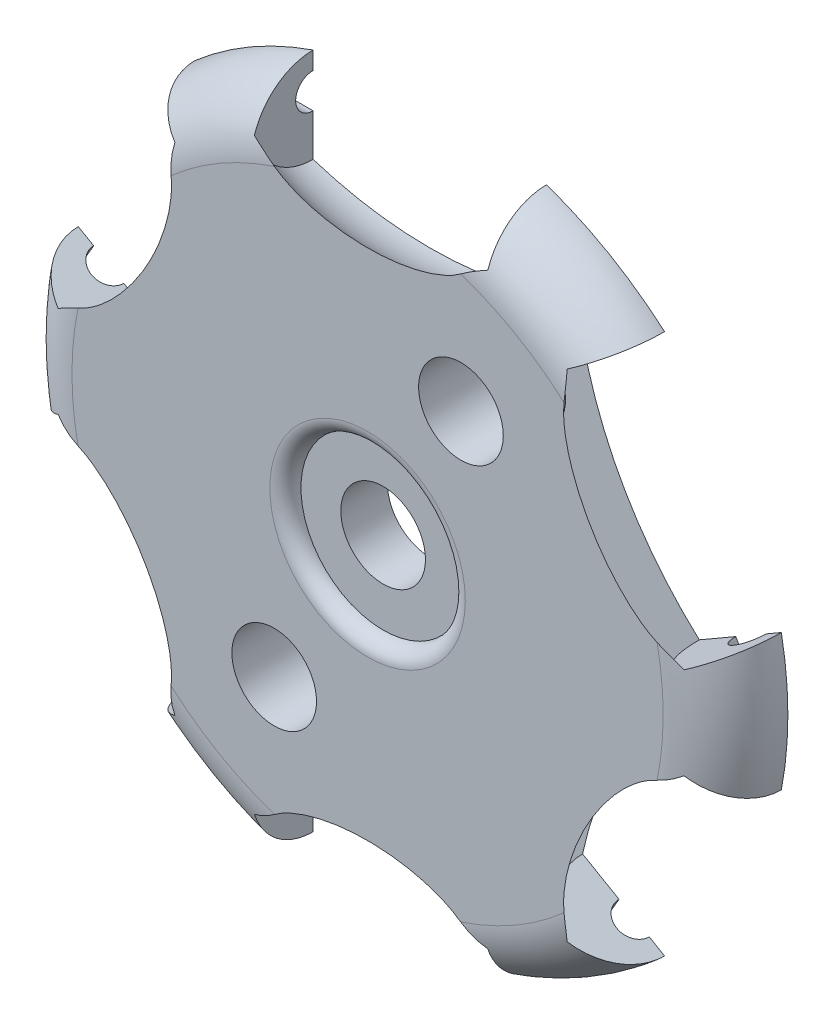
from build123d import *

# Parameters (mm, degrees)
SKETCH1_R           = 18.2626
BOSS_EXTRUDE1_DEPTH = 3.175
FILLET1_R           = 3.18516
SKETCH2_R           = 2.159
CUT_EXTRUDE1_DEPTH  = 27.021617144
SKETCH6_R           = 0.889
CUT_EXTRUDE2_DEPTH  = 7.9375
CIRPATTERN1_COUNT   = 6
SKETCH9_R           = 4.191
CUT_EXTRUDE5_DEPTH  = 0.79375
FILLET2_R           = 0.79375


# Some blends are built 0.0001 mm under size
with BuildPart() as part:
    # Sketch1 → Boss-Extrude1 (new body)
    with BuildSketch(Plane.XY):
        Circle(SKETCH1_R)
    extrude(amount=BOSS_EXTRUDE1_DEPTH)

    # Fillet1
    # the kernel refuses this fillet: 3.18516 mm, written as the material it takes off along each edge
    with BuildSketch(Plane(origin=(0, 0, 3.175), x_dir=(1, 0, 0), z_dir=(0, -1, 0))) as fillet1_piece_1:
        with BuildLine():
            CenterArc((18.2626 - FILLET1_R, -FILLET1_R), FILLET1_R, 0, 90)
            Line((18.2626 - FILLET1_R, 0), (18.2626, 0))
            Line((18.2626, 0), (18.2626, -FILLET1_R))
        make_face()
    revolve(axis=Axis((0, 0, 3.175), (0, 0, 1)), mode=Mode.SUBTRACT)

    # Sketch2 → Cut-Extrude1 (cut, through all)
    with BuildSketch(Plane.XY.offset(3.175)):
        with Locations((4.7625, 8.248891971)):
            Circle(SKETCH2_R)
        with Locations((-4.7625, -8.248891971)):
            Circle(SKETCH2_R)
        Circle(SKETCH2_R)
    extrude(amount=-CUT_EXTRUDE1_DEPTH, mode=Mode.SUBTRACT)

    # Sketch5 → Cut-Revolve1 (revolve, cut)
    with BuildSketch(Plane.XY):
        with BuildLine():
            Line((-5.953125, 15.4686), (5.953125, 15.4686))
            Line((5.953125, 15.4686), (5.953125, 18.503266678))
            ThreePointArc((5.953125, 18.503266678), (0, 19.43735), (-5.953125, 18.503266678))
            Line((-5.953125, 18.503266678), (-5.953125, 15.4686))
        make_face()
    cut_revolve1 = revolve(axis=Axis((-5.953125, 15.4686, 0), (-1, 0, 0)), mode=Mode.SUBTRACT)

    # Sketch6 → Cut-Extrude2 (cut, symmetric)
    with BuildSketch(Plane(origin=(0, 0, 0), x_dir=(0, 0, -1), z_dir=(1, 0, 0))):
        with Locations((0, 15.4686)):
            Circle(SKETCH6_R)
    cut_extrude2 = extrude(amount=CUT_EXTRUDE2_DEPTH, both=True, mode=Mode.SUBTRACT)

    # CirPattern1: Cut-Revolve1, Cut-Extrude2 ×6 about axis
    cirpattern1_axis = Axis((0, 0, 0), (0, 0, 1))
    add([cut_revolve1.rotate(cirpattern1_axis, i * 360 / CIRPATTERN1_COUNT) for i in range(1, CIRPATTERN1_COUNT)], mode=Mode.SUBTRACT)
    add([cut_extrude2.rotate(cirpattern1_axis, i * 360 / CIRPATTERN1_COUNT) for i in range(1, CIRPATTERN1_COUNT)], mode=Mode.SUBTRACT)

    # Sketch9 → Cut-Extrude5 (cut)
    with BuildSketch(Plane.XY.offset(3.175)):
        Circle(SKETCH9_R)
    extrude(amount=-CUT_EXTRUDE5_DEPTH, mode=Mode.SUBTRACT)

    # Fillet2
    fillet2_edges = [part.edges().sort_by_distance(p)[0] for p in [
        (-4.191, 0, 3.175),
    ]]
    fillet(fillet2_edges, radius=FILLET2_R - 0.0001)  # a hair under: the kernel refuses the full size


solid = part.part
